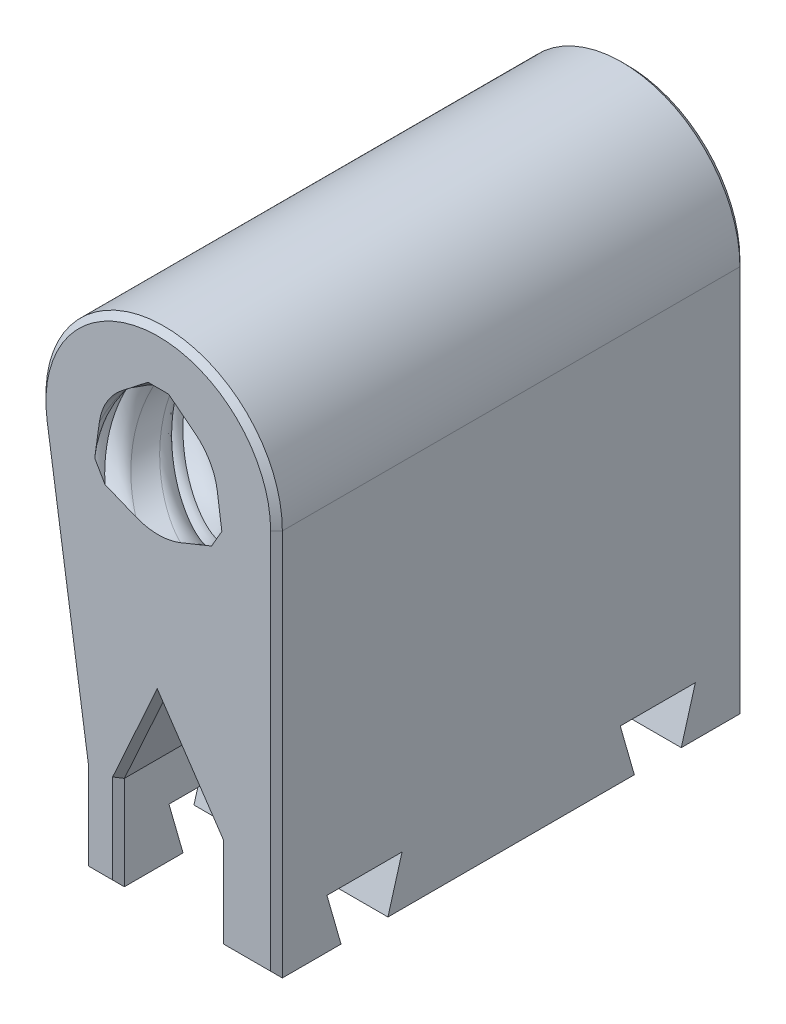
from build123d import *

# Parameters (mm, degrees)
SKETCH1_R           = 10.15
SKETCH1_W           = 10
SKETCH1_H           = 16
SKETCH1_W_2         = 6.14
BOSS_EXTRUDE1_DEPTH = 80
CUT_EXTRUDE1_DEPTH  = 102.698144034
CUT_SWEEP3_PITCH    = 40
CIRPATTERN1_COUNT   = 3
CHAMFER1_SIZE       = 1
CHAMFER2_SIZE       = 1


with BuildPart() as part:
    # Sketch1 → Boss-Extrude1 (new body)
    # profile 1 of 4: a face of its own
    with BuildSketch(Plane.XY):
        with BuildLine():
            ThreePointArc((-39.547489125, 25.029418201), (-18.128293757, 7.905117759), (0.532341376, 28))
            ThreePointArc((0.532341376, 28), (-21.107023492, 48.094882241), (-39.547489125, 25.029418201))
        make_face()
        with Locations((-19.617658624, 28)):
            Circle(SKETCH1_R, mode=Mode.SUBTRACT)
    # profile 2 of 4: a face of its own
    with BuildSketch(Plane.XY):
        with BuildLine():
            Line((0.532341376, -22), (0.532341376, 28))
            ThreePointArc((0.532341376, 28), (-18.128293757, 7.905117759), (-39.547489125, 25.029418201))
            Line((-39.547489125, 25.029418201), (-32.537658624, -22))
            Line((-32.537658624, -22), (-26.397658624, -22))
            Line((-26.397658624, -22), (-19.617658624, -7))
            Line((-19.617658624, -7), (-9.467658624, -22))
            Line((-9.467658624, -22), (0.532341376, -22))
        make_face()
    # profile 3 of 4: a face of its own
    with BuildSketch(Plane.XY):
        with Locations((-4.467658624, -30)):
            Rectangle(SKETCH1_W, SKETCH1_H)
    # profile 4 of 4: a face of its own
    with BuildSketch(Plane.XY):
        with Locations((-29.467658624, -30)):
            Rectangle(SKETCH1_W_2, SKETCH1_H)
    extrude(amount=BOSS_EXTRUDE1_DEPTH)

    # Sketch2 → Cut-Extrude1 (cut, through all)
    with BuildSketch(Plane(origin=(0.532341376, 0, 0), x_dir=(0, 0, -1), z_dir=(1, 0, 0))):
        Polygon((-69, -38), (-65, -38), (-65, -29.6), (-71.4, -29.6), align=None)
        Polygon((-65, -38), (-61, -38), (-58.6, -29.6), (-65, -29.6), align=None)
        Polygon((-21.4, -29.6), (-19, -38), (-15, -38), (-15, -29.6), align=None)
        Polygon((-15, -29.6), (-15, -38), (-11, -38), (-8.6, -29.6), align=None)
    extrude(amount=-CUT_EXTRUDE1_DEPTH, mode=Mode.SUBTRACT)

    # Cut-Sweep3: the profile of Sketch3 screwed along a right-hand helix of 2.25 turns, 26 arcs to a turn; built about Z, then put on its axis
    cut_sweep3_z = Axis((0, 0, 0), (0, 0, 1))
    cut_sweep3_corners = [(8.00978922, -6.234242267, 0), (11.5, -1.75, 0), (11.5, 1.75, 0), (8.00978922, 6.234242267, 0)]
    with BuildLine(mode=Mode.PRIVATE) as cut_sweep3_profile:
        Line(cut_sweep3_corners[0], cut_sweep3_corners[1])
        Line(cut_sweep3_corners[1], cut_sweep3_corners[2])
        Line(cut_sweep3_corners[2], cut_sweep3_corners[3])
        ThreePointArc((8.00978922, 6.234242267, 0), (10.15, 0, 0), (8.00978922, -6.234242267, 0))
    cut_sweep3_cap = Face(cut_sweep3_profile.wire())
    cut_sweep3_arcs = [((8.00978922, 6.234242267, 0), (12.862073791, 0, 0), (8.00978922, -6.234242267, 0), (1, 0.7891417950919337, 1))]  # start, shoulder, end, weights
    cut_sweep3_turn_angles = [0, 6.923076923, 13.846153846, 20.769230769, 27.692307692, 34.615384615, 41.538461538, 48.461538462, 55.384615385, 62.307692308, 69.230769231, 76.153846154, 83.076923077, 90, 96.923076923, 103.846153846, 110.769230769, 117.692307692, 124.615384615, 131.538461538, 138.461538462, 145.384615385, 152.307692308, 159.230769231, 166.153846154, 173.076923077, 180, 186.923076923, 193.846153846, 200.769230769, 207.692307692, 214.615384615, 221.538461538, 228.461538462, 235.384615385, 242.307692308, 249.230769231, 256.153846154, 263.076923077, 270, 276.923076923, 283.846153846, 290.769230769, 297.692307692, 304.615384615, 311.538461538, 318.461538462, 325.384615385, 332.307692308, 339.230769231, 346.153846154, 353.076923077, 360]
    cut_sweep3_turn_weights = [1, 0.992708874098054, 1, 0.992708874098054, 1, 0.992708874098054, 1, 0.992708874098054, 1, 0.992708874098054, 1, 0.992708874098054, 1, 0.992708874098054, 1, 0.992708874098054, 1, 0.992708874098054, 1, 0.992708874098054, 1, 0.992708874098054, 1, 0.992708874098054, 1, 0.992708874098054, 1, 0.992708874098054, 1, 0.992708874098054, 1, 0.992708874098054, 1, 0.992708874098054, 1, 0.992708874098054, 1, 0.992708874098054, 1, 0.9927088740980541, 1, 0.992708874098054, 1, 0.992708874098054, 1, 0.9927088740980541, 1, 0.992708874098054, 1, 0.992708874098054, 1, 0.9927088740980541, 1]
    cut_sweep3_turn_rails = [Edge.make_bspline([Vector(p[0], p[1], 0).rotate(cut_sweep3_z, cut_sweep3_turn_angles[k]) / cut_sweep3_turn_weights[k] + Vector(0, 0, p[2] + CUT_SWEEP3_PITCH * cut_sweep3_turn_angles[k] / 360) for k in range(53)], [0, 0, 0, 1, 1, 2, 2, 3, 3, 4, 4, 5, 5, 6, 6, 7, 7, 8, 8, 9, 9, 10, 10, 11, 11, 12, 12, 13, 13, 14, 14, 15, 15, 16, 16, 17, 17, 18, 18, 19, 19, 20, 20, 21, 21, 22, 22, 23, 23, 24, 24, 25, 25, 26, 26, 26], 2, cut_sweep3_turn_weights) for p in cut_sweep3_corners]
    cut_sweep3_turn_sides = [*[Face.make_surface_from_curves(cut_sweep3_turn_rails[p[0]], cut_sweep3_turn_rails[p[1]]) for p in [(0, 1), (1, 2), (2, 3)]], *[Face.make_bezier_surface([[Vector(p[j][0], p[j][1], 0).rotate(cut_sweep3_z, cut_sweep3_turn_angles[2 * i + k]) / cut_sweep3_turn_weights[2 * i + k] + Vector(0, 0, p[j][2] + CUT_SWEEP3_PITCH * cut_sweep3_turn_angles[2 * i + k] / 360) for k in range(3)] for j in range(3)], [[p[3][j] * cut_sweep3_turn_weights[2 * i + k] for k in range(3)] for j in range(3)]) for p in cut_sweep3_arcs for i in range(26)]]
    cut_sweep3_last_angles = [720, 726.923076923, 733.846153846, 740.769230769, 747.692307692, 754.615384615, 761.538461538, 768.461538462, 775.384615385, 782.307692308, 789.230769231, 796.153846154, 803.076923077, 806.538461538, 810]
    cut_sweep3_last_weights = [1, 0.9927088740980541, 1, 0.9927088740980539, 1, 0.9927088740980541, 1, 0.9927088740980541, 1, 0.9927088740980539, 1, 0.9927088740980541, 1, 0.9981755542233165, 1]
    cut_sweep3_last_rails = [Edge.make_bspline([Vector(p[0], p[1], 0).rotate(cut_sweep3_z, cut_sweep3_last_angles[k]) / cut_sweep3_last_weights[k] + Vector(0, 0, p[2] + CUT_SWEEP3_PITCH * cut_sweep3_last_angles[k] / 360) for k in range(15)], [0, 0, 0, 1, 1, 2, 2, 3, 3, 4, 4, 5, 5, 6, 6, 7, 7, 7], 2, cut_sweep3_last_weights) for p in cut_sweep3_corners]
    cut_sweep3_last_sides = [*[Face.make_surface_from_curves(cut_sweep3_last_rails[p[0]], cut_sweep3_last_rails[p[1]]) for p in [(0, 1), (1, 2), (2, 3)]], *[Face.make_bezier_surface([[Vector(p[j][0], p[j][1], 0).rotate(cut_sweep3_z, cut_sweep3_last_angles[2 * i + k]) / cut_sweep3_last_weights[2 * i + k] + Vector(0, 0, p[j][2] + CUT_SWEEP3_PITCH * cut_sweep3_last_angles[2 * i + k] / 360) for k in range(3)] for j in range(3)], [[p[3][j] * cut_sweep3_last_weights[2 * i + k] for k in range(3)] for j in range(3)]) for p in cut_sweep3_arcs for i in range(7)]]
    cut_sweep3 = Plane(origin=(-19.617658624, 28, 0), x_dir=(0, 1, 0), z_dir=(0, 0, 1)) * Solid(Shell([*[p.moved(Location((0, 0, CUT_SWEEP3_PITCH * i))) for i in range(2) for p in cut_sweep3_turn_sides], *cut_sweep3_last_sides, cut_sweep3_cap, cut_sweep3_cap.rotate(cut_sweep3_z, 810).moved(Location((0, 0, CUT_SWEEP3_PITCH * 810 / 360)))]))
    add(cut_sweep3, mode=Mode.SUBTRACT)

    # CirPattern1: Cut-Sweep3 ×3 about axis
    cirpattern1_axis = Axis((-19.617658624, 28, 80), (0, 0, -1))
    for i in range(1, CIRPATTERN1_COUNT):
        add(cut_sweep3.rotate(cirpattern1_axis, i * 360 / CIRPATTERN1_COUNT), mode=Mode.SUBTRACT)

    # Chamfer1
    chamfer1_edges = [part.edges().sort_by_distance(p)[0] for p in [
        (-21.107023492, 48.094882241, 80),
        (-36.042573875, 1.514709101, 80),
        (-23.007658624, -14.5, 80),
        (-14.542658624, -14.5, 80),
        (-9.467658624, -30, 80),
        (-32.537658624, -30, 80),
        (-29.467658624, -38, 80),
        (-26.397658624, -30, 80),
        (-4.467658624, -38, 80),
        (0.532341376, -5, 80),
    ]]
    chamfer(chamfer1_edges, length=CHAMFER1_SIZE)

    # Chamfer2
    chamfer2_edges = [part.edges().sort_by_distance(p)[0] for p in [
        (-4.467658624, -38, 0),
        (-9.467658624, -30, 0),
        (-14.542658624, -14.5, 0),
        (-23.007658624, -14.5, 0),
        (-36.042573875, 1.514709101, 0),
        (-21.107023492, 48.094882241, 0),
        (0.532341376, -5, 0),
        (-32.537658624, -30, 0),
        (-29.467658624, -38, 0),
        (-26.397658624, -30, 0),
    ]]
    chamfer(chamfer2_edges, length=CHAMFER2_SIZE)


solid = part.part
